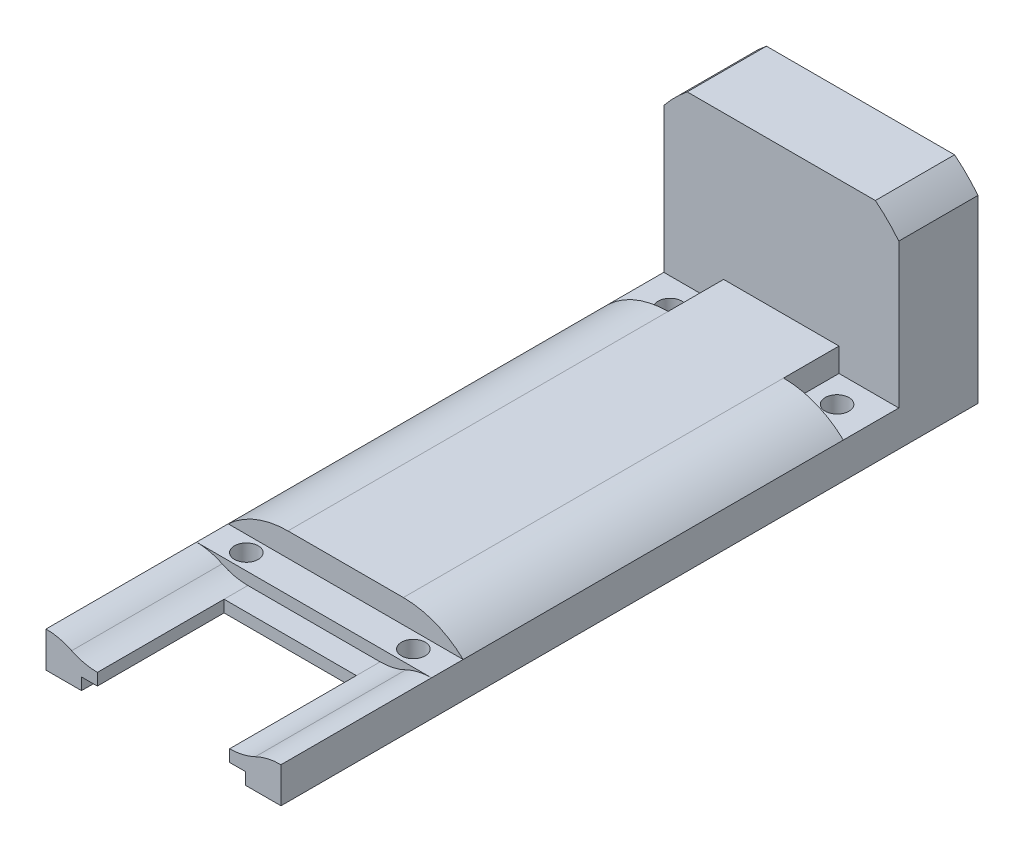
from build123d import *

# Parameters (mm, degrees)
SKETCH1_W               = 6.485
SKETCH1_H               = 4.5
BOSS_EXTRUDE1_DEPTH     = 88
BOSS_EXTRUDE1_2_DEPTH   = 88
SKETCH3_W               = 2
SKETCH3_H               = 1.5
CUT_EXTRUDE2_DEPTH      = 30
SKETCH4_W               = 2
SKETCH4_H               = 4.5
CUT_EXTRUDE3_DEPTH      = 65
BOSS_EXTRUDE2_REACH     = 93.644
SKETCH6_W               = 67
SKETCH6_H               = 3
BOSS_EXTRUDE3_DEPTH     = 5
CUT_EXTRUDE4_DEPTH      = 5
BOSS_EXTRUDE4_DEPTH     = 5
BOSS_EXTRUDE5_START     = 7
BOSS_EXTRUDE5_DEPTH     = 48
BOSS_EXTRUDE6_DEPTH     = 48
FILLET1_R               = 11
SKETCH18_W              = 14.57033113
SKETCH18_H              = 3
BOSS_EXTRUDE7_DEPTH     = 7
SKETCH15_W              = 23.7
SKETCH15_H              = 21.22267295
CUT_EXTRUDE6_DEPTH      = 7
SKETCH16_W              = 16.7
SKETCH16_H              = 1.5
CUT_EXTRUDE7_DEPTH      = 19
CUT_EXTRUDE5_DEPTH      = 92.727000479
CUT_EXTRUDE5_DEPTH_BACK = 92.727000479
SKETCH13_R              = 1.5
SKETCH17_W              = 14
SKETCH17_H              = 55
CUT_EXTRUDE8_DEPTH      = 3


with BuildPart() as part:
    # Sketch1 → Boss-Extrude1 (new body)
    with BuildSketch(Plane.XY):
        with Locations((-11.5925, 2.25)):
            Rectangle(SKETCH1_W, SKETCH1_H)
    extrude(amount=-BOSS_EXTRUDE1_DEPTH)


with BuildPart() as body_2:
    # Sketch1 → Boss-Extrude1 2 (new body)
    with BuildSketch(Plane.XY):
        with Locations((11.5925, 2.25)):
            Rectangle(SKETCH1_W, SKETCH1_H)
    extrude(amount=-BOSS_EXTRUDE1_2_DEPTH)


with BuildPart() as cut_extrude2_tool:
    # Sketch3 → Cut-Extrude2 (new body)
    with BuildSketch(Plane.XY):
        with Locations((-9.35, 0.75)):
            Rectangle(SKETCH3_W, SKETCH3_H)
        with Locations((9.35, 0.75)):
            Rectangle(SKETCH3_W, SKETCH3_H)
    extrude(amount=-CUT_EXTRUDE2_DEPTH)


with BuildPart() as part_1:
    add(part.part)

    # Cut-Extrude2: cut by cut_extrude2_tool
    add(cut_extrude2_tool.part, mode=Mode.SUBTRACT)


with BuildPart() as body_2_1:
    add(body_2.part)

    # Cut-Extrude2: cut by cut_extrude2_tool
    add(cut_extrude2_tool.part, mode=Mode.SUBTRACT)


with BuildPart() as cut_extrude3_tool:
    # Sketch4 → Cut-Extrude3 (new body)
    with BuildSketch(Plane(origin=(0, 0, -88), x_dir=(-1, 0, 0), z_dir=(0, 0, -1))):
        with Locations((9.35, 2.25)):
            Rectangle(SKETCH4_W, SKETCH4_H)
        with Locations((-9.35, 2.25)):
            Rectangle(SKETCH4_W, SKETCH4_H)
    extrude(amount=-CUT_EXTRUDE3_DEPTH)


with BuildPart() as part_2:
    add(part_1.part)

    # Cut-Extrude3: cut by cut_extrude3_tool
    add(cut_extrude3_tool.part, mode=Mode.SUBTRACT)


with BuildPart() as body_2_2:
    add(body_2_1.part)

    # Cut-Extrude3: cut by cut_extrude3_tool
    add(cut_extrude3_tool.part, mode=Mode.SUBTRACT)

    # Boss-Extrude2: up to this face of the body (flat: up to its plane)
    boss_extrude2_end = Plane(body_2_2.part.faces().sort_by_distance((10.35, 2.091743119, -50.857798165))[0])
    # Sketch6 → Boss-Extrude2 (add, up to the picked face)
    with BuildSketch(Plane(origin=(-10.35, 0, 0), x_dir=(0, 0, -1), z_dir=(1, 0, 0)), mode=Mode.PRIVATE) as boss_extrude2_sk1:
        with Locations((49.5, 3)):
            Rectangle(SKETCH6_W, SKETCH6_H)
    boss_extrude2_tool1 = split(extrude(boss_extrude2_sk1.sketch, amount=BOSS_EXTRUDE2_REACH, mode=Mode.PRIVATE), bisect_by=boss_extrude2_end, keep=Keep.BOTH, mode=Mode.PRIVATE)

    add(part_2.part)  # Boss-Extrude2 merges part
    add(boss_extrude2_tool1.solids().sort_by(Axis((-10.35, 3, -49.5), (1, 0, 0)))[0])

    # Sketch8 → Boss-Extrude3 (add)
    with BuildSketch(Plane(origin=(0, 0, -88), x_dir=(-1, 0, 0), z_dir=(0, 0, -1))):
        Polygon((-14.835, 25.70767295), (-14.835, 4.5), (-10.35, 4.5), (-10.35, 21.22267295), (10.35, 21.22267295), (10.35, 4.5), (14.835, 4.5), (14.835, 25.70767295), align=None)
    extrude(amount=-BOSS_EXTRUDE3_DEPTH)

    # Sketch9 → Cut-Extrude4 (cut)
    with BuildSketch(Plane(origin=(0, 0, -88), x_dir=(-1, 0, 0), z_dir=(0, 0, -1))):
        with BuildLine():
            Line((-15.009070225, 25.881743175), (-15.009070225, 22.527310239))
            ThreePointArc((-15.009070225, 22.527310239), (-13.436955933, 24.309628883), (-11.654637289, 25.881743175))
            Line((-11.654637289, 25.881743175), (-15.009070225, 25.881743175))
        make_face()
        with BuildLine():
            Line((15.009070225, 25.881743175), (15.009070225, 22.527310239))
            ThreePointArc((15.009070225, 22.527310239), (13.436955933, 24.309628883), (11.654637289, 25.881743175))
            Line((11.654637289, 25.881743175), (15.009070225, 25.881743175))
        make_face()
    extrude(amount=-CUT_EXTRUDE4_DEPTH, mode=Mode.SUBTRACT)

    # Sketch11 → Boss-Extrude4 (add)
    with BuildSketch(Plane.XY.offset(-83)):
        with BuildLine():
            Line((14.835, 4.5), (14.835, 22.748097759))
            ThreePointArc((14.835, 22.748097759), (13.436955933, 24.309628883), (11.875424809, 25.70767295))
            Line((11.875424809, 25.70767295), (-11.875424809, 25.70767295))
            ThreePointArc((-11.875424809, 25.70767295), (-13.436955933, 24.309628883), (-14.835, 22.748097759))
            Line((-14.835, 22.748097759), (-14.835, 4.5))
            Line((-14.835, 4.5), (14.835, 4.5))
        make_face()
    extrude(amount=BOSS_EXTRUDE4_DEPTH)

    # Sketch12 → Boss-Extrude5 (add)
    with BuildSketch(Plane.XY.offset(-78).offset(BOSS_EXTRUDE5_START)):
        Polygon((-14.835, 4.5), (-11.835, 7.5), (11.835, 7.5), (14.835, 4.5), align=None)
    extrude(amount=BOSS_EXTRUDE5_DEPTH)

    # Sketch14 → Boss-Extrude6 (add)
    with BuildSketch(Plane.XY.offset(-23)):
        Polygon((-11.835, 7.5), (-14.835, 4.5), (-10.835, 4.5), (-10.835, 7.5), align=None)
        Polygon((11.835, 7.5), (14.835, 4.5), (10.835, 4.5), (10.835, 7.5), align=None)
    extrude(amount=-BOSS_EXTRUDE6_DEPTH)

    # Fillet1
    # the kernel refuses this fillet: 11 mm, written as the material it takes off along each edge
    with BuildSketch(Plane(origin=(11.835, 7.5, -82.374586088), x_dir=(-1, 0, 0), z_dir=(0, 0, 1))) as fillet1_piece_1_section:
        with BuildLine():
            CenterArc((4.549834435, 11), FILLET1_R, 226.658241773, 43.341758227)
            Line((-3, 3), (0, 0))
            Line((0, 0), (4.549834435, 0))
        make_face()
    fillet1_piece_1 = extrude(amount=70.749172176, mode=Mode.PRIVATE)
    fillet1_piece_1 = split(fillet1_piece_1, bisect_by=Plane(origin=(11.355308805, 6.742969198, -78), z_dir=(0, 0, 1)), keep=Keep.TOP, mode=Mode.PRIVATE)
    add(fillet1_piece_1, mode=Mode.SUBTRACT)
    with BuildSketch(Plane(origin=(-11.835, 7.5, -82.374586088), x_dir=(1, 0, 0), z_dir=(0, 0, 1))) as fillet1_piece_2_section:
        with BuildLine():
            CenterArc((4.549834435, -11), FILLET1_R, 90, 43.341758227)
            Line((-3, -3), (0, 0))
            Line((0, 0), (4.549834435, 0))
        make_face()
    fillet1_piece_2 = extrude(amount=70.749172176, mode=Mode.PRIVATE)
    fillet1_piece_2 = split(fillet1_piece_2, bisect_by=Plane(origin=(-11.355308805, 6.742969198, -78), z_dir=(0, 0, 1)), keep=Keep.TOP, mode=Mode.PRIVATE)
    add(fillet1_piece_2, mode=Mode.SUBTRACT)

    # Sketch18 → Boss-Extrude7 (add)
    with BuildSketch(Plane(origin=(0, 0, -71), x_dir=(-1, 0, 0), z_dir=(0, 0, -1))):
        with Locations((0, 6)):
            Rectangle(SKETCH18_W, SKETCH18_H)
    extrude(amount=BOSS_EXTRUDE7_DEPTH)

    # Sketch15 → Cut-Extrude6 (cut)
    with BuildSketch(Plane(origin=(0, 0, -88), x_dir=(-1, 0, 0), z_dir=(0, 0, -1))):
        with Locations((0, 12.111336475)):
            Rectangle(SKETCH15_W, SKETCH15_H)
    extrude(amount=-CUT_EXTRUDE6_DEPTH, mode=Mode.SUBTRACT)

    # Sketch16 → Cut-Extrude7 (cut)
    with BuildSketch(Plane.XY):
        with BuildLine():
            ThreePointArc((11.5925, 3.75), (10.014054255, 3.189942939), (8.35, 3))
            Line((8.35, 3), (8.35, 4.5))
            Line((8.35, 4.5), (14.835, 4.5))
            ThreePointArc((14.835, 4.5), (13.170945745, 4.310057061), (11.5925, 3.75))
        make_face()
        with BuildLine():
            ThreePointArc((-11.5925, 3.75), (-10.014054255, 3.189942939), (-8.35, 3))
            Line((-8.35, 3), (-8.35, 4.5))
            Line((-8.35, 4.5), (-14.835, 4.5))
            ThreePointArc((-14.835, 4.5), (-13.170945745, 4.310057061), (-11.5925, 3.75))
        make_face()
        with Locations((0, 3.75)):
            Rectangle(SKETCH16_W, SKETCH16_H)
    extrude(amount=-CUT_EXTRUDE7_DEPTH, mode=Mode.SUBTRACT)

    # Sketch13 → Cut-Extrude5 (cut, two sides: drawn at the far end of the back side and taken through both)
    with BuildSketch(Plane(origin=(0, 4.5, 0), x_dir=(1, 0, 0), z_dir=(0, 1, 0)).offset(-CUT_EXTRUDE5_DEPTH_BACK)):
        with Locations(Location((10.542662348, 74.5, 0), (0, 0, 97.379545614))):
            Circle(SKETCH13_R)
        with Locations(Location((-10.542662348, 74.5, 0), (0, 0, 277.379545614))):
            Circle(SKETCH13_R)
        with Locations(Location((10.542662348, 21, 0), (0, 0, 97.379545614))):
            Circle(SKETCH13_R)
        with Locations(Location((-10.542662348, 21, 0), (0, 0, 277.379545614))):
            Circle(SKETCH13_R)
    extrude(amount=CUT_EXTRUDE5_DEPTH + CUT_EXTRUDE5_DEPTH_BACK, mode=Mode.SUBTRACT)

    # Sketch17 → Cut-Extrude8 (cut)
    with BuildSketch(Plane(origin=(0, 1.5, 0), x_dir=(-1, 0, 0), z_dir=(0, -1, 0))):
        with Locations((0, 53.5)):
            Rectangle(SKETCH17_W, SKETCH17_H)
    extrude(amount=-CUT_EXTRUDE8_DEPTH, mode=Mode.SUBTRACT)


solid = body_2_2.part
